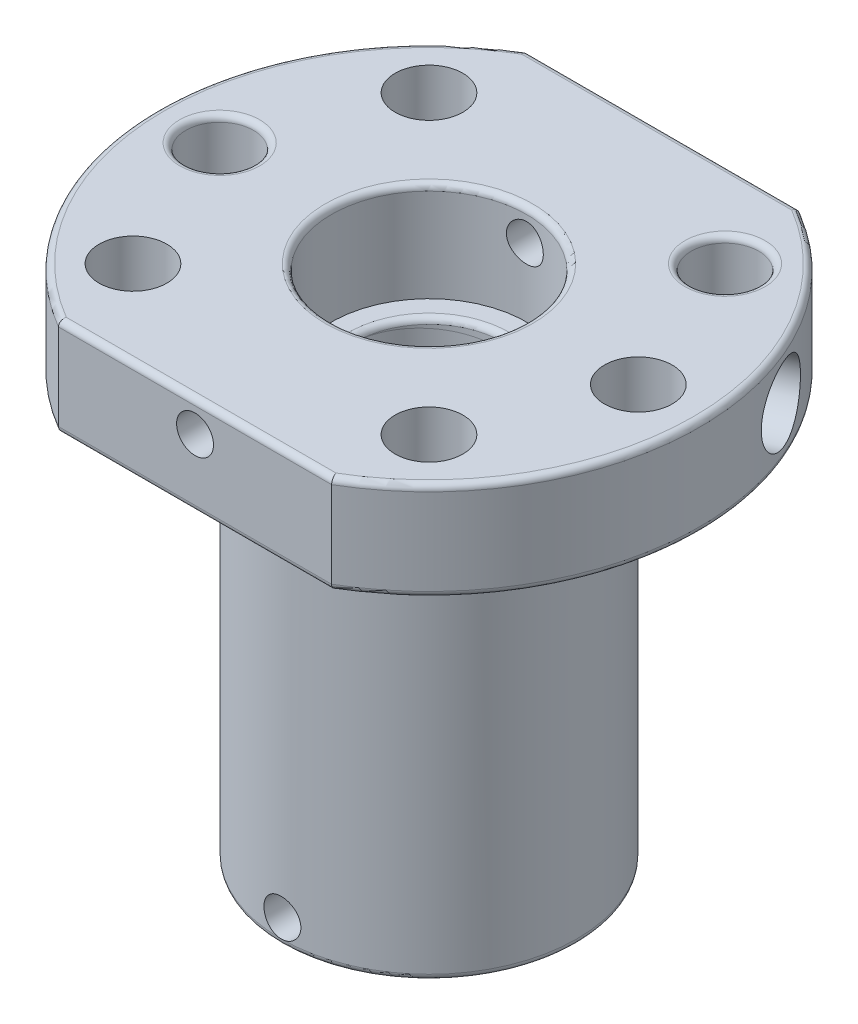
from build123d import *

# Parameters (mm, degrees)
KES_EKSTR_ZYON1_START  = -10
KES_EKSTR_ZYON1_DEPTH  = 10
IZIM3_R                = 2.75
KES_EKSTR_ZYON2_DEPTH  = 10
RADYUS1_R              = 0.5
IZIM4_R                = 2.5
KES_EKSTR_ZYON3_DEPTH  = 20
IZIM5_R                = 3
KES_EKSTR_ZYON4_DEPTH  = 10
RADYUS2_R              = 0.5
IZIM6_R                = 1.5
KES_EKSTR_ZYON5_DEPTH  = 61.761830292
IZIM8_R                = 1.5
KES_EKSTR_ZYON6_DEPTH  = 41
KES_S_P_R3_START       = 13.772406133
KES_S_P_R3_OUTLINE_R   = 6.003343816
KES_S_P_R3_OUTLINE_R_2 = 6
KES_S_P_R3_DEPTH       = 19.716657792


# Read off the part's stored shape, not the designer's step: Kes-Süpür3
with BuildPart() as part:
    # Çizim1 → Döndür1 (revolve)
    with BuildSketch(Plane.XY, mode=Mode.PRIVATE) as d_nd_r1_sk:
        Polygon((-9, 0), (-9, 13.33013521), (-6, 13.33013521), (-6, 33.931334848), (-7.925872199, 33.931334848), (-7.925872199, 42), (-22, 42), (-22, 34), (-12, 34), (-12, 0), align=None)
    revolve(d_nd_r1_sk.sketch.rotate(Axis((0, 66.207607335, 0), (0, -1, 0)), 270), axis=Axis((0, 66.207607335, 0), (0, -1, 0)))

    # Çizim2 → Kes-Ekstrüzyon1 (cut)
    with BuildSketch(Plane(origin=(0, 42, 0), x_dir=(1, 0, 0), z_dir=(0, 1, 0)).offset(KES_EKSTR_ZYON1_START)):
        with BuildLine():
            Line((-11.090536506, 19), (11.090536506, 19))
            ThreePointArc((11.090536506, 19), (0, 22), (-11.090536506, 19))
        make_face()
        with BuildLine():
            Line((-11.090536506, -19), (11.090536506, -19))
            ThreePointArc((11.090536506, -19), (0, -22), (-11.090536506, -19))
        make_face()
    extrude(amount=KES_EKSTR_ZYON1_DEPTH, mode=Mode.SUBTRACT)

    # Çizim3 → Kes-Ekstrüzyon2 (cut)
    with BuildSketch(Plane(origin=(0, 42, 0), x_dir=(1, 0, 0), z_dir=(0, 1, 0))):
        with Locations(Location((-17, 0, 0), (0, 0, 270))):
            Circle(IZIM3_R)
        with Locations(Location((-12.02081528, 12.02081528, 0), (0, 0, 270))):
            Circle(IZIM3_R)
        with Locations(Location((12.02081528, 12.02081528, 0), (0, 0, 270))):
            Circle(IZIM3_R)
        with Locations(Location((17, 0, 0), (0, 0, 270))):
            Circle(IZIM3_R)
        with Locations(Location((12.02081528, -12.02081528, 0), (0, 0, 270))):
            Circle(IZIM3_R)
        with Locations(Location((-12.02081528, -12.02081528, 0), (0, 0, 270))):
            Circle(IZIM3_R)
    extrude(amount=-KES_EKSTR_ZYON2_DEPTH, mode=Mode.SUBTRACT)

    # Radyus1
    radyus1_edges = [part.edges().sort_by_distance(p)[0] for p in [
        (0, 33.931334848, -6),
        (0, 13.33013521, -6),
        (0, 0, -9),
        (-12.02081528, 34, -14.77081528),
        (12.02081528, 34, -14.77081528),
        (12.02081528, 42, -14.77081528),
        (12.02081528, 34, 9.27081528),
        (-12.02081528, 34, 9.27081528),
        (-17, 34, -2.75),
        (-17, 42, -2.75),
        (0, 0, -12),
        (0, 42, -7.925872199),
    ]]
    fillet(radyus1_edges, radius=RADYUS1_R)

    # Çizim4 → Kes-Ekstrüzyon3 (cut)
    with BuildSketch(Plane(origin=(20.251106776, 0, -8.596084827), x_dir=(0, 1, 0), z_dir=(0.9205048534524413, 0, -0.39073112848927144))):
        with Locations(Location((38, 0, 0), (0, 0, 270))):
            Circle(IZIM4_R)
    extrude(amount=-KES_EKSTR_ZYON3_DEPTH, mode=Mode.SUBTRACT)

    # Çizim5 → Kes-Ekstrüzyon4 (cut)
    with BuildSketch(Plane(origin=(20.251106776, 0, -8.596084827), x_dir=(0, 1, 0), z_dir=(0.9205048534524413, 0, -0.39073112848927144))):
        with Locations(Location((38, 0, 0), (0, 0, 270))):
            Circle(IZIM5_R)
    extrude(amount=-KES_EKSTR_ZYON4_DEPTH, mode=Mode.SUBTRACT)

    # Radyus2
    radyus2_edges = [part.edges().sort_by_distance(p)[0] for p in [
        (-22, 34, 0),
        (0, 34, 19),
        (0, 34, -19),
        (-22, 42, 0),
        (0, 42, -19),
        (0, 42, 19),
        (17, 34, -2.75),
        (0, 34, -12),
        (22, 34, 0),
        (22, 42, 0),
    ]]
    fillet(radyus2_edges, radius=RADYUS2_R)

    # Çizim6 → Kes-Ekstrüzyon5 (cut, through all)
    with BuildSketch(Plane.XY.offset(19)):
        with Locations((0, 39.5)):
            Circle(IZIM6_R)
    extrude(amount=-KES_EKSTR_ZYON5_DEPTH, mode=Mode.SUBTRACT)

    # Çizim8 → Kes-Ekstrüzyon6 (cut)
    with BuildSketch(Plane.YX.offset(12)):
        with Locations(Location((2, 0, 0), (0, 0, 180))):
            Circle(IZIM8_R)
    extrude(amount=-KES_EKSTR_ZYON6_DEPTH, mode=Mode.SUBTRACT)

    # Kes-Süpür3 outline → Kes-Süpür3 (cut)
    with BuildSketch(Plane(origin=(0, 0, 0), x_dir=(1, 0, 0), z_dir=(0, 1, 0)).offset(KES_S_P_R3_START)):
        Circle(KES_S_P_R3_OUTLINE_R)
        Circle(KES_S_P_R3_OUTLINE_R_2, mode=Mode.SUBTRACT)
    extrude(amount=KES_S_P_R3_DEPTH, mode=Mode.SUBTRACT)


solid = part.part
